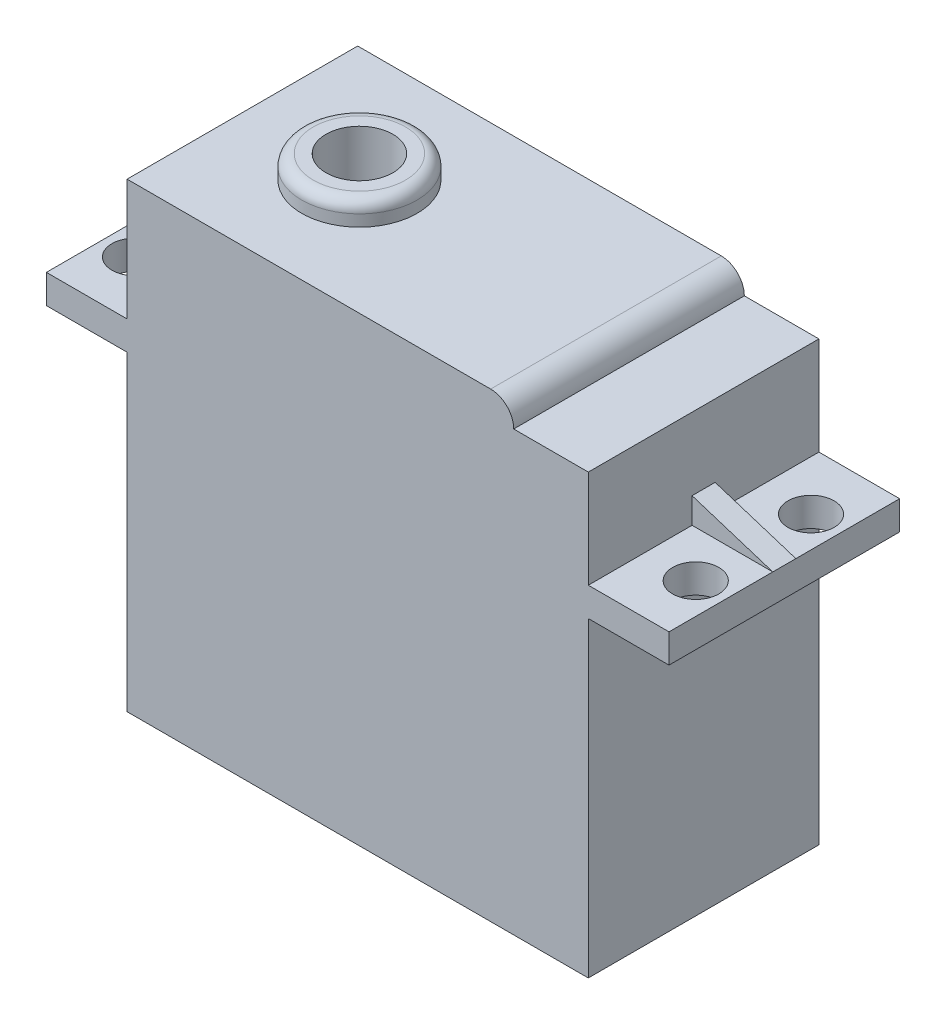
from build123d import *

# Parameters (mm, degrees)
EXTRUDE_1_DEPTH     = 27
SKETCH_3_R          = 2
EXTRUDE_2_DEPTH     = 2.5
EXTRUDE_3_DEPTH     = 8.5
SKETCH_5_W          = 33.531111889
SKETCH_5_H          = 20
EXTRUDE_4_DEPTH     = 2
FILLET_5_R          = 2
SKETCH_6_R          = 5
EXTRUDE_5_DEPTH     = 2
FILLET_7_R          = 1
SKETCH_7_R          = 2.9
CUT_EXTRUDE_1_DEPTH = 27
RIB_8_REACH         = 41.472
SKETCH_8_WALL_W     = 88.288518024
SKETCH_8_WALL_H     = 2


with BuildPart() as part:
    # 草图2 → 凸台-拉伸1 (new body)
    with BuildSketch(Plane(origin=(0, 0, 0), x_dir=(1, 0, 0), z_dir=(0, 1, 0))):
        Polygon((0, -10), (-20, -10), (-20, 10), (20, 10), (20, -10), align=None)
    extrude(amount=-EXTRUDE_1_DEPTH)

    # 草图3 → 凸台-拉伸2 (add)
    with BuildSketch(Plane(origin=(0, 0, 0), x_dir=(1, 0, 0), z_dir=(0, 1, 0))):
        Polygon((0, 10), (27, 10), (27, -10), (-27, -10), (-27, 10), align=None)
        with Locations(Location((-24.315, -5, 0), (0, 0, 270))):
            Circle(SKETCH_3_R, mode=Mode.SUBTRACT)
        with Locations(Location((-24.315, 5, 0), (0, 0, 90))):
            Circle(SKETCH_3_R, mode=Mode.SUBTRACT)
        with Locations(Location((24.315, -5, 0), (0, 0, 90))):
            Circle(SKETCH_3_R, mode=Mode.SUBTRACT)
        with Locations(Location((24.315, 5, 0), (0, 0, 270))):
            Circle(SKETCH_3_R, mode=Mode.SUBTRACT)
    extrude(amount=EXTRUDE_2_DEPTH)

    # 草图4 → 凸台-拉伸3 (add)
    with BuildSketch(Plane(origin=(0, 2.5, 0), x_dir=(1, 0, 0), z_dir=(0, 1, 0))):
        Polygon((0, 10), (-20, 10), (-20, -10), (20, -10), (20, 10), align=None)
    extrude(amount=EXTRUDE_3_DEPTH)

    # 草图5 → 凸台-拉伸4 (add)
    with BuildSketch(Plane(origin=(0, 11, 0), x_dir=(1, 0, 0), z_dir=(0, 1, 0))):
        with Locations((-3.234444055, 0)):
            Rectangle(SKETCH_5_W, SKETCH_5_H)
    extrude(amount=EXTRUDE_4_DEPTH)

    # 圆角5
    fillet_5_edges = [part.edges().sort_by_distance(p)[0] for p in [
        (13.531111889, 13, 0),
    ]]
    fillet(fillet_5_edges, radius=FILLET_5_R - 0.0001)  # a hair under: the kernel refuses the full size

    # 草图6 → 凸台-拉伸5 (add)
    with BuildSketch(Plane(origin=(0, 13, 0), x_dir=(1, 0, 0), z_dir=(0, 1, 0))):
        with Locations(Location((-9.85, 0, 0), (0, 0, 90))):
            Circle(SKETCH_6_R)
    extrude(amount=EXTRUDE_5_DEPTH)

    # 圆角7
    fillet_7_edges = [part.edges().sort_by_distance(p)[0] for p in [
        (-9.85, 15, 5),
    ]]
    fillet(fillet_7_edges, radius=FILLET_7_R)

    # 草图7 → 切除-拉伸1 (cut)
    with BuildSketch(Plane(origin=(0, 15, 0), x_dir=(1, 0, 0), z_dir=(0, 1, 0))):
        with Locations(Location((-9.85, 0, 0), (0, 0, 270))):
            Circle(SKETCH_7_R)
    extrude(amount=-CUT_EXTRUDE_1_DEPTH, mode=Mode.SUBTRACT)

    # 草图8 wall → 筋8 (add, up to next)
    with BuildSketch(Plane(origin=(-23.5, 3.613146338, 0), x_dir=(0.952964322003, 0.303082498652, 0), z_dir=(-0.303082498652, 0.952964322003, 0)), mode=Mode.PRIVATE) as rib_8_sk1:
        Rectangle(SKETCH_8_WALL_W, SKETCH_8_WALL_H)
    rib_8_tool1 = extrude(rib_8_sk1.sketch, amount=-RIB_8_REACH, mode=Mode.PRIVATE) - part.part
    rib_8 = rib_8_tool1.solids().sort_by_distance((-23.5, 3.613146338, 0))[0]
    add(rib_8)

    # 镜向1: 筋8 across plane
    add(rib_8.mirror(Plane(origin=(0, 0, 0), x_dir=(0, 0, 1), z_dir=(1, 0, 0))))


solid = part.part
